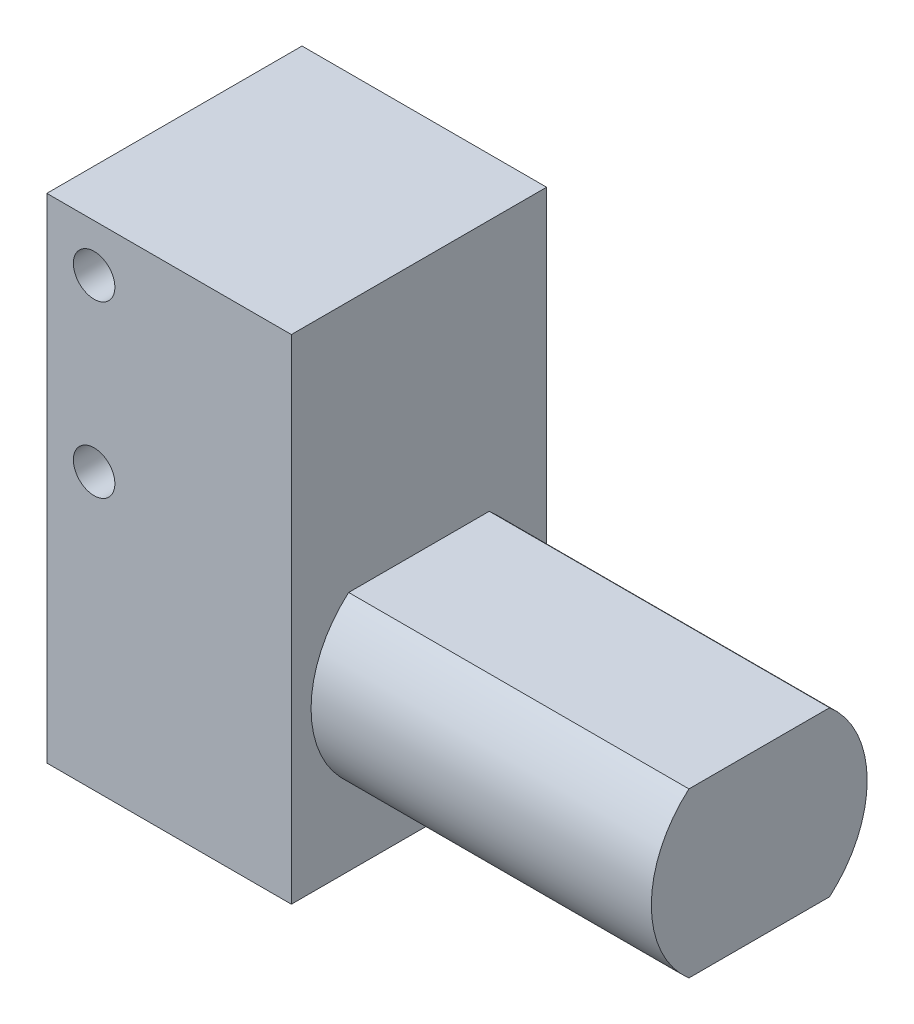
from build123d import *

# Parameters (mm, degrees)
SKETCH1_W               = 23
SKETCH1_H               = 46.4
BOSS_EXTRUDE1_DEPTH     = 12
SKETCH6_R               = 1.95
CUT_EXTRUDE1_DEPTH      = 5.5
SKETCH7_R               = 2.7
BOSS_EXTRUDE2_DEPTH     = 9
SKETCH8_W               = 7
SKETCH8_H               = 0.95
CUT_EXTRUDE2_DEPTH      = 54.159759217
SKETCH9_R               = 1.95
CUT_EXTRUDE3_DEPTH      = 5.5
SKETCH10_R              = 10.15
BOSS_EXTRUDE3_DEPTH     = 32
CUT_EXTRUDE4_DEPTH      = 73.951764886
CUT_EXTRUDE4_DEPTH_BACK = 73.951764886
SKETCH11_W              = 32
SKETCH11_H              = 2.45
SKETCH12_W              = 3
SKETCH12_H              = 9
CUT_EXTRUDE5_DEPTH      = 5


with BuildPart() as part:
    # Sketch1 → Boss-Extrude1 (new, symmetric)
    with BuildSketch(Plane.XY):
        with Locations((11.5, 23.2)):
            Rectangle(SKETCH1_W, SKETCH1_H)
    extrude(amount=BOSS_EXTRUDE1_DEPTH, both=True)

    # Sketch6 → Cut-Extrude1 (cut)
    with BuildSketch(Plane.XY.offset(12)):
        with Locations((4.45, 41.95)):
            Circle(SKETCH6_R)
        with Locations((4.45, 25.95)):
            Circle(SKETCH6_R)
    cut_extrude1 = extrude(amount=-CUT_EXTRUDE1_DEPTH, mode=Mode.SUBTRACT)

    # Mirror1: Cut-Extrude1 across plane
    add(cut_extrude1.mirror(Plane.XY), mode=Mode.SUBTRACT)

    # Sketch7 → Boss-Extrude2 (add)
    with BuildSketch(Plane.ZY):
        with Locations((0, 34.2)):
            Circle(SKETCH7_R)
    extrude(amount=BOSS_EXTRUDE2_DEPTH)

    # Sketch8 → Cut-Extrude2 (cut, through all)
    with BuildSketch(Plane(origin=(0, 0, 0), x_dir=(1, 0, 0), z_dir=(0, 1, 0))):
        with Locations((-5.5, 2.225)):
            Rectangle(SKETCH8_W, SKETCH8_H)
        with Locations((-5.5, -2.225)):
            Rectangle(SKETCH8_W, SKETCH8_H)
    extrude(amount=CUT_EXTRUDE2_DEPTH, mode=Mode.SUBTRACT)

    # Sketch9 → Cut-Extrude3 (cut)
    with BuildSketch(Plane.ZY):
        with Locations((-8, 10.45)):
            Circle(SKETCH9_R)
        with Locations((8, 10.45)):
            Circle(SKETCH9_R)
    extrude(amount=-CUT_EXTRUDE3_DEPTH, mode=Mode.SUBTRACT)

    # Sketch10 → Boss-Extrude3 (add)
    with BuildSketch(Plane(origin=(23, 0, 0), x_dir=(0, 0, -1), z_dir=(1, 0, 0))):
        with Locations((0, 15)):
            Circle(SKETCH10_R)
    extrude(amount=BOSS_EXTRUDE3_DEPTH)

    # Sketch11 → Cut-Extrude4 (cut, two sides: drawn at the far end of the back side and taken through both)
    with BuildSketch(Plane.XY.offset(-CUT_EXTRUDE4_DEPTH_BACK)):
        with Locations((39, 23.925)):
            Rectangle(SKETCH11_W, SKETCH11_H)
        with Locations((39, 6.075)):
            Rectangle(SKETCH11_W, SKETCH11_H)
    extrude(amount=CUT_EXTRUDE4_DEPTH + CUT_EXTRUDE4_DEPTH_BACK, mode=Mode.SUBTRACT)

    # Sketch12 → Cut-Extrude5 (cut)
    with BuildSketch(Plane.XZ):
        with Locations((14.5, 0)):
            Rectangle(SKETCH12_W, SKETCH12_H)
    extrude(amount=-CUT_EXTRUDE5_DEPTH, mode=Mode.SUBTRACT)


solid = part.part
